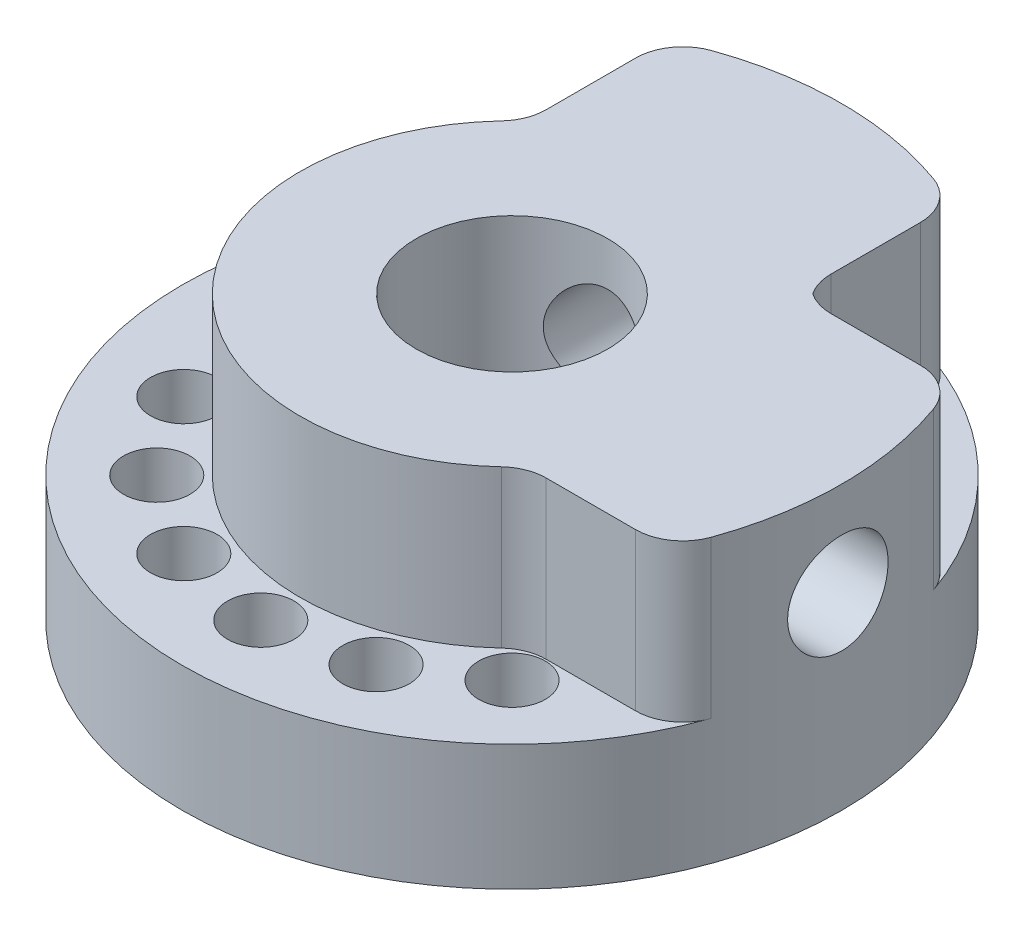
from build123d import *
from build123d.topology import SkipClean

# Parameters (mm, degrees)
SKETCH1_R                = 5.25
SKETCH1_R_2              = 0.53
SKETCH1_R_3              = 1.525
BOSS_EXTRUDE1_DEPTH      = 2
SKETCH2_R                = 3.375
SKETCH2_R_2              = 1.525
BOSS_EXTRUDE2_DEPTH      = 2.5
SKETCH3_R                = 0.8
CUT_EXTRUDE1_DEPTH       = 3.5
BOSS_EXTRUDE3_REACH      = 12.386
BOSS_EXTRUDE3_END_RADIUS = 5.25
SKETCH5_W                = 4.534589286
SKETCH5_H                = 2.5
SKETCH5_R                = 0.8
BOSS_EXTRUDE4_REACH      = 12.386
BOSS_EXTRUDE4_END_RADIUS = 5.25
SKETCH6_W                = 4.534589286
SKETCH6_H                = 2.5
SKETCH6_R                = 0.8
CUT_EXTRUDE2_DEPTH       = 10
CUT_EXTRUDE2_DEPTH_BACK  = 3
SKETCH6_3_R              = 0.8
FILLET1_R                = 0.75
FILLET2_R                = 0.75


with BuildPart() as part:
    # Sketch1 → Boss-Extrude1 (new body)
    with BuildSketch(Plane(origin=(0, 0, 0), x_dir=(1, 0, 0), z_dir=(0, 1, 0))):
        with Locations(Location((0, 0, 0), (0, 0, 270))):
            Circle(SKETCH1_R)
        with Locations(Location((0, 4, 0), (0, 0, 270))):
            Circle(SKETCH1_R_2, mode=Mode.SUBTRACT)
        with Locations(Location((1.530733729, 3.69551813, 0), (0, 0, 270))):
            Circle(SKETCH1_R_2, mode=Mode.SUBTRACT)
        with Locations(Location((2.828427125, 2.828427125, 0), (0, 0, 270))):
            Circle(SKETCH1_R_2, mode=Mode.SUBTRACT)
        with Locations(Location((3.69551813, 1.530733729, 0), (0, 0, 270))):
            Circle(SKETCH1_R_2, mode=Mode.SUBTRACT)
        with Locations(Location((4, 0, 0), (0, 0, 270))):
            Circle(SKETCH1_R_2, mode=Mode.SUBTRACT)
        with Locations(Location((3.69551813, -1.530733729, 0), (0, 0, 270))):
            Circle(SKETCH1_R_2, mode=Mode.SUBTRACT)
        with Locations(Location((2.828427125, -2.828427125, 0), (0, 0, 270))):
            Circle(SKETCH1_R_2, mode=Mode.SUBTRACT)
        with Locations(Location((1.530733729, -3.69551813, 0), (0, 0, 270))):
            Circle(SKETCH1_R_2, mode=Mode.SUBTRACT)
        with Locations(Location((0, -4, 0), (0, 0, 270))):
            Circle(SKETCH1_R_2, mode=Mode.SUBTRACT)
        with Locations(Location((-1.530733729, -3.69551813, 0), (0, 0, 270))):
            Circle(SKETCH1_R_2, mode=Mode.SUBTRACT)
        with Locations(Location((-2.828427125, -2.828427125, 0), (0, 0, 270))):
            Circle(SKETCH1_R_2, mode=Mode.SUBTRACT)
        with Locations(Location((-3.69551813, -1.530733729, 0), (0, 0, 270))):
            Circle(SKETCH1_R_2, mode=Mode.SUBTRACT)
        with Locations(Location((-4, 0, 0), (0, 0, 270))):
            Circle(SKETCH1_R_2, mode=Mode.SUBTRACT)
        with Locations(Location((-3.69551813, 1.530733729, 0), (0, 0, 270))):
            Circle(SKETCH1_R_2, mode=Mode.SUBTRACT)
        with Locations(Location((-2.828427125, 2.828427125, 0), (0, 0, 270))):
            Circle(SKETCH1_R_2, mode=Mode.SUBTRACT)
        with Locations(Location((-1.530733729, 3.69551813, 0), (0, 0, 270))):
            Circle(SKETCH1_R_2, mode=Mode.SUBTRACT)
        with Locations(Location((0, 0, 0), (0, 0, 270))):
            Circle(SKETCH1_R_3, mode=Mode.SUBTRACT)
    extrude(amount=BOSS_EXTRUDE1_DEPTH)

    # Sketch2 → Boss-Extrude2 (add)
    with BuildSketch(Plane(origin=(0, 2, 0), x_dir=(1, 0, 0), z_dir=(0, 1, 0))):
        with Locations(Location((0, 0, 0), (0, 0, 270))):
            Circle(SKETCH2_R)
        with Locations(Location((0, 0, 0), (0, 0, 270))):
            Circle(SKETCH2_R_2, mode=Mode.SUBTRACT)
    extrude(amount=BOSS_EXTRUDE2_DEPTH)

    # Sketch3 → Cut-Extrude1 (cut)
    with BuildSketch(Plane.XY):
        with Locations(Location((0, 3, 0), (0, 0, 90))):
            Circle(SKETCH3_R)
    extrude(amount=-CUT_EXTRUDE1_DEPTH, mode=Mode.SUBTRACT)

    # Boss-Extrude3: up to this cylinder (the profile starts inside it)
    with SkipClean():  # the faces are left unmerged after this step: merging them gives an invalid solid
        boss_extrude3_end = Plane(origin=(0, 2.051781, 0), z_dir=(0, -1, 0)) * Cylinder(BOSS_EXTRUDE3_END_RADIUS, 36.272, mode=Mode.PRIVATE)
        # Sketch5 → Boss-Extrude3 (add, up to the surface)
        with BuildSketch(Plane.XY.offset(-2.5), mode=Mode.PRIVATE) as boss_extrude3_sk1:
            with Locations((0, 3.25)):
                Rectangle(SKETCH5_W, SKETCH5_H)
            with Locations((0, 3)):
                Circle(SKETCH5_R, mode=Mode.SUBTRACT)
        boss_extrude3_tool1 = extrude(boss_extrude3_sk1.sketch, amount=-BOSS_EXTRUDE3_REACH, mode=Mode.PRIVATE) & boss_extrude3_end
        add(boss_extrude3_tool1.solids().sort_by_distance((0, 2.051781, -2.5))[0])

    # Boss-Extrude4: up to this cylinder (the profile starts inside it)
    with SkipClean():  # the faces are left unmerged after this step: merging them gives an invalid solid
        boss_extrude4_end = Plane(origin=(0, 3.25, 0), z_dir=(0, -1, 0)) * Cylinder(BOSS_EXTRUDE4_END_RADIUS, 36.272, mode=Mode.PRIVATE)
        # Sketch6 → Boss-Extrude4 (add, up to the surface)
        with BuildSketch(Plane(origin=(2.5, 0, 0), x_dir=(0, 0, -1), z_dir=(1, 0, 0)), mode=Mode.PRIVATE) as boss_extrude4_sk1:
            with Locations((0, 3.25)):
                Rectangle(SKETCH6_W, SKETCH6_H)
            with Locations(Location((0, 3, 0), (0, 0, 180))):
                Circle(SKETCH6_R, mode=Mode.SUBTRACT)
        boss_extrude4_tool1 = extrude(boss_extrude4_sk1.sketch, amount=BOSS_EXTRUDE4_REACH, mode=Mode.PRIVATE) & boss_extrude4_end
        add(boss_extrude4_tool1.solids().sort_by_distance((2.5, 3.25, 2.215514))[0])

    # Sketch6<3> → Cut-Extrude2 (cut, two sides: drawn at the far end of the back side and taken through both)
    with SkipClean():  # the faces are left unmerged after this step: merging them gives an invalid solid
        with BuildSketch(Plane(origin=(2.5, 0, 0), x_dir=(0, 0, -1), z_dir=(1, 0, 0)).offset(-CUT_EXTRUDE2_DEPTH_BACK)):
            with Locations(Location((0, 3, 0), (0, 0, 180))):
                Circle(SKETCH6_3_R)
        extrude(amount=CUT_EXTRUDE2_DEPTH + CUT_EXTRUDE2_DEPTH_BACK, mode=Mode.SUBTRACT)

    # Fillet1
    fillet1_edges = [part.edges().sort_by_distance(p)[0] for p in [
        (2.267294643, 3.25, -4.735174231),
        (-2.267294643, 3.25, -4.735174231),
        (4.735174231, 3.25, 2.267294643),
        (4.735174231, 3.25, -2.267294643),
    ]]
    fillet(fillet1_edges, radius=FILLET1_R)

    # Fillet2
    # the kernel refuses this fillet: 0.75 mm, written as the material it adds along each edge
    with BuildSketch(Plane(origin=(2.267294643, 4.5, -2.5), x_dir=(0, 0, -1), z_dir=(0, -1, 0))) as fillet2_piece_1:
        with BuildLine():
            CenterArc((0.312749195, 0.75), FILLET2_R, 227.009382104, 42.990617896)
            ThreePointArc((-0.198659749, 0.201400974), (-0.09721877, 0.102782858), (0, 0))
            Line((0, 0), (0.312749195, 0))
        make_face()
    extrude(amount=3.281872988)
    with BuildSketch(Plane(origin=(-2.267294643, 1.218127012, -2.5), x_dir=(-0.7119351792170611, 0, 0.7022451855250923), z_dir=(0, 1, 0))) as fillet2_piece_2:
        with BuildLine():
            CenterArc((0.314324768, -0.749341043), FILLET2_R, 92.40196785, 42.990617896)
            Line((-0.219626617, -0.222657154), (0, 0))
            ThreePointArc((0, 0), (0.141446146, -0.002965304), (0.282892291, 0))
        make_face()
    extrude(amount=3.281872988)
    with BuildSketch(Plane(origin=(2.5, 1.218127012, 2.267294643), x_dir=(1, 0, 0), z_dir=(0, 1, 0))) as fillet2_piece_3:
        with BuildLine():
            CenterArc((0.312749195, -0.75), FILLET2_R, 90, 42.990617896)
            ThreePointArc((-0.198659749, -0.201400974), (-0.09721877, -0.102782858), (0, 0))
            Line((0, 0), (0.312749195, 0))
        make_face()
    extrude(amount=3.281872988)
    with BuildSketch(Plane(origin=(2.5, 4.5, -2.267294643), x_dir=(-0.7022451855250915, 0, -0.7119351792170617), z_dir=(0, -1, 0))) as fillet2_piece_4:
        with BuildLine():
            CenterArc((0.314324768, 0.749341043), FILLET2_R, 224.607414254, 42.990617896)
            Line((-0.219626617, 0.222657154), (0, 0))
            ThreePointArc((0, 0), (0.141446146, 0.002965304), (0.282892291, 0))
        make_face()
    extrude(amount=3.281872988)


solid = part.part
